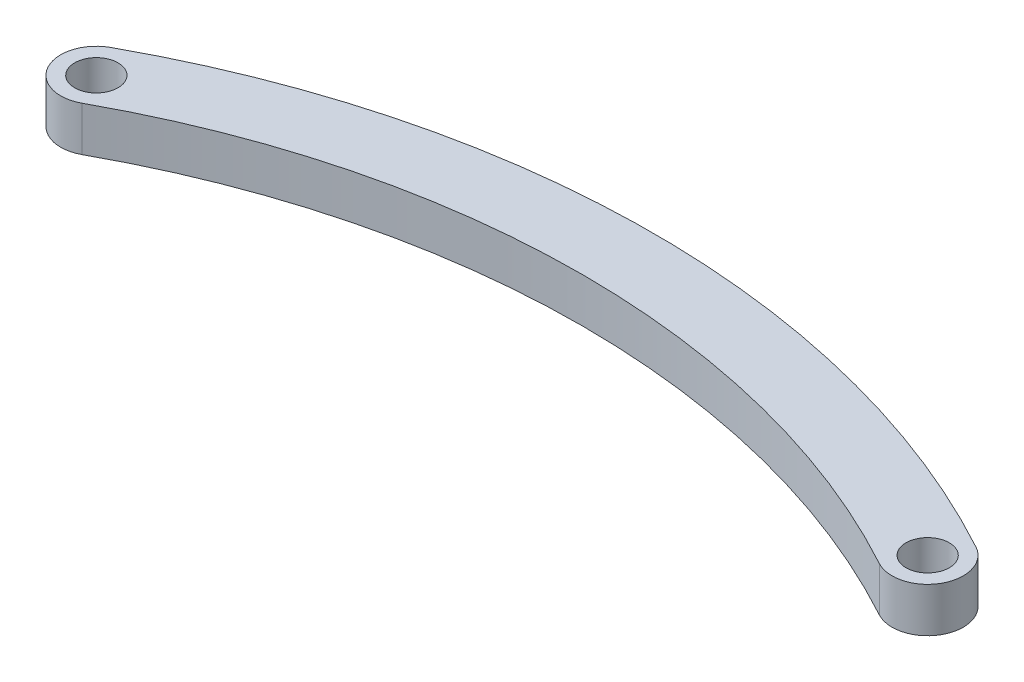
from build123d import *

# Parameters (mm, degrees)
ESQUISSE1_R        = 1.825
BOSS_EXTRU_1_DEPTH = 3.75


with BuildPart() as part:
    # Esquisse1 → Boss.-Extru.1 (new body)
    with BuildSketch(Plane(origin=(0, 0, 0), x_dir=(1, 0, 0), z_dir=(0, 1, 0))):
        with BuildLine():
            ThreePointArc((-36.438356038, 2.632704296), (-37.632704242, -1.438356135), (-33.561643767, -2.632704189))
            ThreePointArc((-33.561643767, -2.632704189), (6.8e-08, 5.937530488), (33.561643886, -2.632704254))
            ThreePointArc((33.561643886, -2.632704254), (37.632704286, -1.438356055), (36.438355996, 2.632704318))
            ThreePointArc((36.438355996, 2.632704318), (-2.4e-08, 11.937530488), (-36.438356038, 2.632704296))
        make_face()
        with Locations((-35, 0)):
            Circle(ESQUISSE1_R, mode=Mode.SUBTRACT)
        with Locations((35, 0)):
            Circle(ESQUISSE1_R, mode=Mode.SUBTRACT)
    extrude(amount=BOSS_EXTRU_1_DEPTH)


solid = part.part
